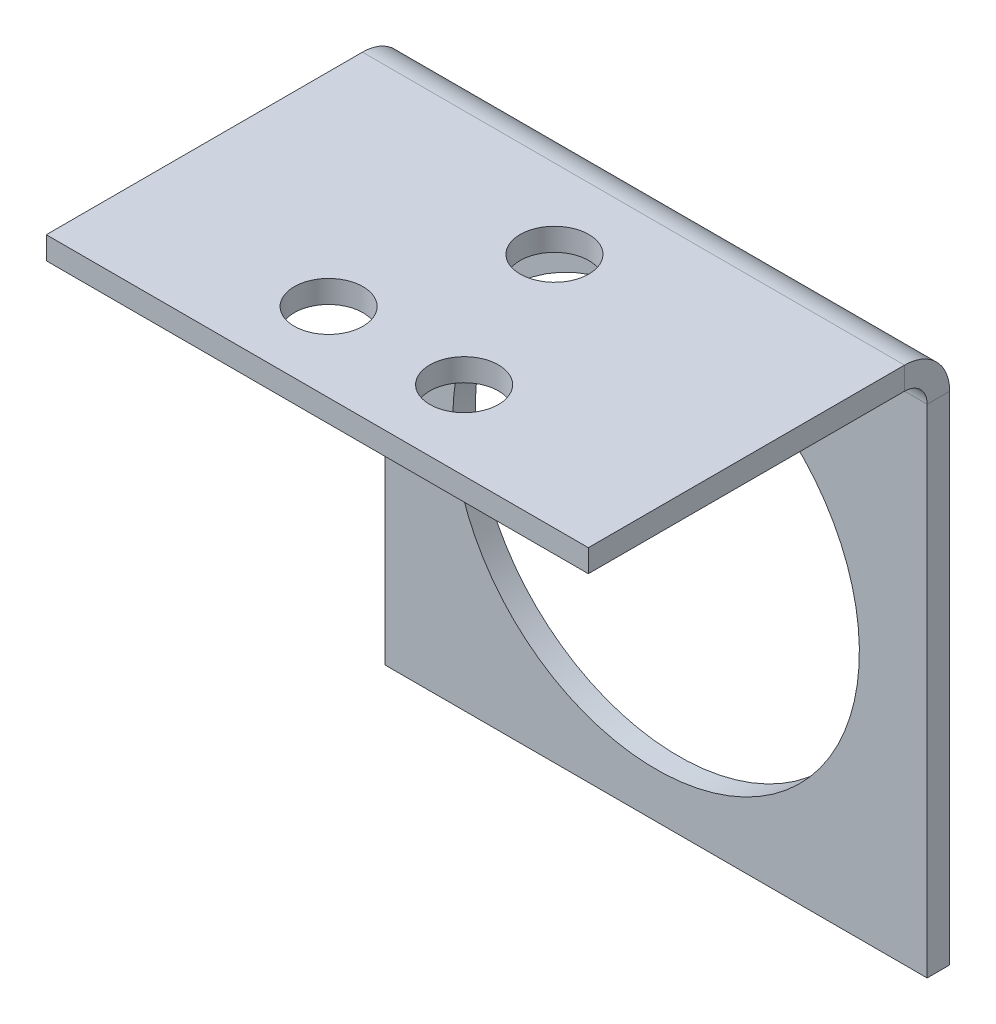
from build123d import *

# Parameters (mm, degrees)
BASE_FLANGE1_DEPTH = 38.1
SKETCH6_R          = 2.413
CUT_EXTRUDE2_DEPTH = 2.54
SKETCH8_R          = 14.2875
CUT_EXTRUDE3_DEPTH = 2.54


# Sheet-metal steps are written as plain solids
with BuildPart() as part:
    # Sketch1 → Base-Flange1 (new body)
    with BuildSketch(Plane(origin=(0, 0, 0), x_dir=(0, 0, -1), z_dir=(1, 0, 0))):
        with BuildLine():
            Line((-25.4, 0), (-3.175, 0))
            ThreePointArc((-3.175, 0), (-0.92993597, -0.92993597), (0, -3.175))
            Line((0, -3.175), (0, -38.1))
            Line((0, -38.1), (-1.5875, -38.1))
            Line((-1.5875, -38.1), (-1.5875, -3.175))
            ThreePointArc((-1.5875, -3.175), (-2.052467985, -2.052467985), (-3.175, -1.5875))
            Line((-3.175, -1.5875), (-25.4, -1.5875))
            Line((-25.4, -1.5875), (-25.4, 0))
        make_face()
    extrude(amount=BASE_FLANGE1_DEPTH)

    # Sketch6 → Cut-Extrude2 (cut)
    with BuildSketch(Plane(origin=(0, 0, 0), x_dir=(1, 0, 0), z_dir=(0, 1, 0))):
        with Locations(Location((23.8125, -19.84375, 0), (0, 0, 270))):
            Circle(SKETCH6_R)
        with Locations(Location((19.05, -8.73125, 0), (0, 0, 270))):
            Circle(SKETCH6_R)
        with Locations(Location((14.2875, -19.84375, 0), (0, 0, 270))):
            Circle(SKETCH6_R)
    extrude(amount=-CUT_EXTRUDE2_DEPTH, mode=Mode.SUBTRACT)

    # Sketch8 → Cut-Extrude3 (cut)
    with BuildSketch(Plane(origin=(0, 0, 0), x_dir=(-1, 0, 0), z_dir=(0, 0, -1))):
        with Locations(Location((-19.05, -20.6375, 0), (0, 0, 90))):
            Circle(SKETCH8_R)
    extrude(amount=-CUT_EXTRUDE3_DEPTH, mode=Mode.SUBTRACT)


solid = part.part
